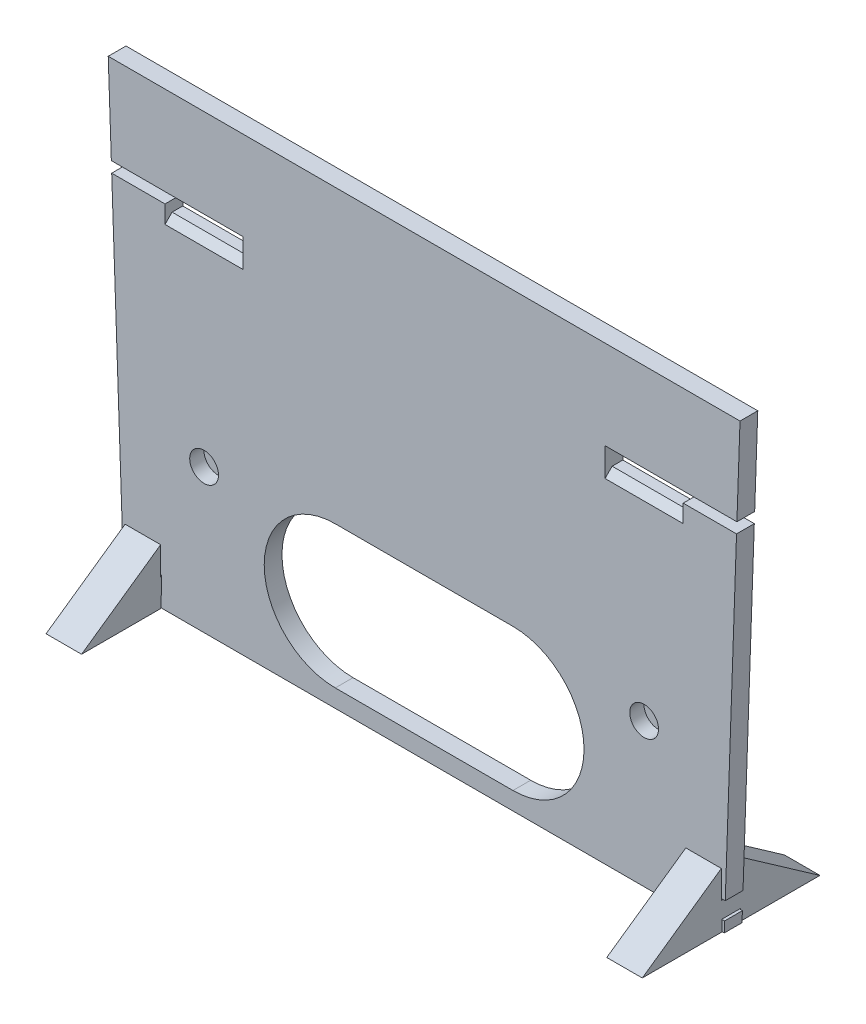
from build123d import *

# Parameters (mm, degrees)
BOSS_EXTRUDE1_DEPTH = 5
CHAMFER1_SIZE       = 2
BOSS_EXTRUDE4_DEPTH = 5
SKETCH2_R           = 4.05
CUT_EXTRUDE2_DEPTH  = 4
BOSS_EXTRUDE2_DEPTH = 10
BOSS_EXTRUDE3_START = -147.8
BOSS_EXTRUDE3_DEPTH = 10
SKETCH4_R           = 4.152826732
SKETCH4_R_2         = 4.151190034
SKETCH4_R_3         = 4.152320734
SKETCH4_R_4         = 4.152602902
CUT_EXTRUDE3_DEPTH  = 3


# Read off the part's stored shape, not the designer's step: Boss-Extrude1, Boss-Extrude4
with BuildPart() as part:
    # Boss-Extrude1 outline → Boss-Extrude1 (new body)
    with BuildSketch(Plane.XY):
        Polygon((-88.9, 63.5), (-88.026980763, 38.5), (-50.922218454, 38.5), (-50.922218454, 32.5), (-72.922218454, 32.5), (-72.922218454, 35.5), (-87.922218454, 35.5), (-84.74442843, -55.5), (-73.9, -55.5), (-73.9, -63.5), (73.9, -63.5), (73.9, -55.5), (84.74442843, -55.5), (87.922218454, 35.5), (72.922218454, 35.5), (72.922218454, 32.5), (50.922218454, 32.5), (50.922218454, 38.5), (88.026980763, 38.5), (88.9, 63.5), align=None)
        with BuildLine():
            Line((-25, -18.5), (25, -18.5))
            ThreePointArc((25, -18.5), (45, -38.5), (25, -58.5))
            Line((25, -58.5), (-25, -58.5))
            ThreePointArc((-25, -58.5), (-45, -38.5), (-25, -18.5))
        make_face(mode=Mode.SUBTRACT)
    extrude(amount=BOSS_EXTRUDE1_DEPTH)

    # Chamfer1
    chamfer1_edges = [part.edges().sort_by_distance(p)[0] for p in [
        (61.922218454, 32.5, 5),
        (-61.922218454, 32.5, 5),
    ]]
    chamfer(chamfer1_edges, length=CHAMFER1_SIZE)

    # Boss-Extrude4 outline → Boss-Extrude4 (add)
    with BuildSketch(Plane.XY):
        Polygon((73.9, -60.5), (73.9, -63.5), (84.465062275, -63.5), (84.569824583, -60.5), align=None)
        Polygon((-84.569824583, -60.5), (-84.465062275, -63.5), (-73.9, -63.5), (-73.9, -60.5), align=None)
    extrude(amount=BOSS_EXTRUDE4_DEPTH)

    # Sketch2 → Cut-Extrude2 (cut)
    with BuildSketch(Plane.XY.offset(5)):
        with Locations((61.919723642, -23.082003832)):
            Circle(SKETCH2_R)
        with Locations(Location((-61.919723642, -23.082003832, 0), (0, 0, 180))):
            Circle(SKETCH2_R)
    extrude(amount=-CUT_EXTRUDE2_DEPTH, mode=Mode.SUBTRACT)

    # Sketch4 → Cut-Extrude3 (cut)
    with BuildSketch(Plane(origin=(0, 0, 0), x_dir=(-1, 0, 0), z_dir=(0, 0, -1))):
        with Locations((47.999909157, -13.250133675)):
            Circle(SKETCH4_R)
        with Locations((-47.001300636, -13.249189401)):
            Circle(SKETCH4_R_2)
        with Locations((-46.999683563, -55.749320844)):
            Circle(SKETCH4_R_3)
        with Locations((47.999996185, -55.749608673)):
            Circle(SKETCH4_R_4)
    extrude(amount=-CUT_EXTRUDE3_DEPTH, mode=Mode.SUBTRACT)


with BuildPart() as body_2:
    # Sketch3 → Boss-Extrude2 (new body)
    with BuildSketch(Plane.ZY.offset(73.9)):
        Polygon((-22.5, -63.5), (-0.125, -63.5), (-0.125, -60.375), (5.125, -60.375), (5.125, -63.5), (27.5, -63.5), (5.25, -47.920382275), (5.25, -55.75), (-0.25, -55.75), (-0.25, -47.920382275), align=None)
    extrude(amount=BOSS_EXTRUDE2_DEPTH)


with BuildPart() as body_3:
    # Sketch3<2> → Boss-Extrude3 (new body)
    with BuildSketch(Plane.ZY.offset(73.9).offset(BOSS_EXTRUDE3_START)):
        Polygon((-22.5, -63.5), (-0.125, -63.5), (-0.125, -60.375), (5.125, -60.375), (5.125, -63.5), (27.5, -63.5), (5.25, -47.920382275), (5.25, -55.75), (-0.25, -55.75), (-0.25, -47.920382275), align=None)
    extrude(amount=-BOSS_EXTRUDE3_DEPTH)


solid = Compound([part.part, body_2.part, body_3.part])
